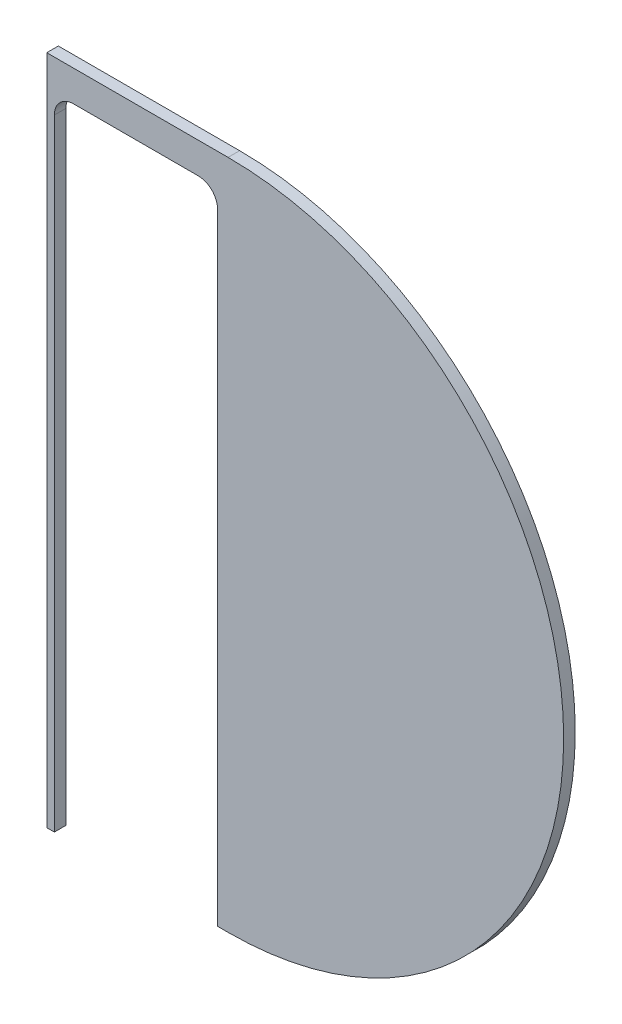
from build123d import *

# Parameters (mm, degrees)
BOSS_EXTRUDE1_DEPTH = 30
CUT_EXTRUDE1_DEPTH  = 2243.529329846


with BuildPart() as part:
    # Sketch1 → Boss-Extrude1 (new body)
    with BuildSketch(Plane.XY):
        with BuildLine():
            Line((0, 0), (470, 0))
            ThreePointArc((470, 0), (1340, 870), (470, 1740))
            Line((470, 1740), (0, 1740))
            Line((0, 1740), (0, 0))
        make_face()
    extrude(amount=BOSS_EXTRUDE1_DEPTH)

    # Sketch2 → Cut-Extrude1 (cut, through all)
    with BuildSketch(Plane(origin=(-149.893544062, 64.252100529, -2), x_dir=(-1, 0, 0), z_dir=(0, 0, -1))):
        with BuildLine():
            Line((-592.773575067, -114.252100529), (-169.572129607, -114.252100529))
            Line((-169.572129607, -114.252100529), (-169.572129607, 1545.594593054))
            ThreePointArc((-169.572129607, 1545.594593054), (-184.216790548, 1580.949932113), (-219.572129607, 1595.594593054))
            Line((-219.572129607, 1595.594593054), (-542.773575067, 1595.594593054))
            ThreePointArc((-542.773575067, 1595.594593054), (-578.128914126, 1580.949932113), (-592.773575067, 1545.594593054))
            Line((-592.773575067, 1545.594593054), (-592.773575067, -114.252100529))
        make_face()
    extrude(amount=-CUT_EXTRUDE1_DEPTH, mode=Mode.SUBTRACT)


solid = part.part
